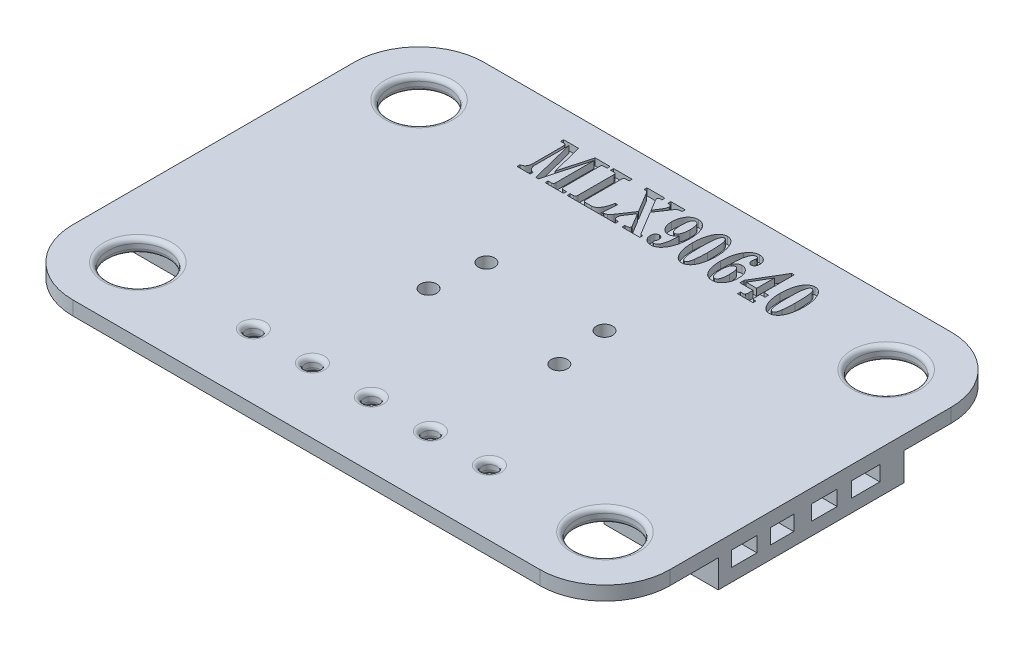
from build123d import *

# Parameters (mm, degrees)
SALIENTE_EXTRUIR1_DEPTH = 0.6
CROQUIS3_R              = 1.27
CROQUIS3_R_2            = 0.32
CROQUIS3_R_3            = 0.35
CORTAR_EXTRUIR1_DEPTH   = 16.614256306
REDONDEO1_R             = 0.2
REDONDEO2_R             = 0.2
CORTAR_EXTRUIR2_DEPTH   = 0.3
SALIENTE_EXTRUIR4_DEPTH = 1.2
REDONDEO3_R             = 0.01
CROQUIS7_W              = 0.961475499
CROQUIS7_H              = 0.984716881
CORTAR_EXTRUIR4_DEPTH   = 2.2
CROQUIS8_W              = 1.224767944
CROQUIS8_H              = 0.647945439
CROQUIS8_W_2            = 1.113290158
CROQUIS8_W_3            = 1.013233318
CROQUIS8_W_4            = 1.085589769
CORTAR_EXTRUIR5_DEPTH   = 2.2
CROQUIS9_W              = 1.132707072
CROQUIS9_H              = 1.963972998
CROQUIS9_H_2            = 0.661482274
CROQUIS9_H_3            = 0.757849479
CROQUIS9_W_2            = 0.741288448
CROQUIS9_H_4            = 1.36671407
CROQUIS9_W_3            = 2.633933759
CROQUIS9_H_5            = 1.322964549
CROQUIS9_W_4            = 1.348997922
CROQUIS9_H_6            = 0.958486138
CROQUIS9_W_5            = 0.714988108
CROQUIS9_H_7            = 0.958169502
CROQUIS9_W_6            = 0.459843401
CROQUIS9_H_8            = 0.258664748
SALIENTE_EXTRUIR5_DEPTH = 0.5
CROQUIS11_W             = 0.808334263
CROQUIS11_H             = 0.95
CORTAR_EXTRUIR7_DEPTH   = 17.744329696


with BuildPart() as part:
    # Croquis2 → Saliente-Extruir1 (new body)
    with BuildSketch(Plane(origin=(0, 0, 0), x_dir=(1, 0, 0), z_dir=(0, 1, 0))):
        with BuildLine():
            Line((-10.05, 8.85), (10.05, 8.85))
            ThreePointArc((10.05, 8.85), (12.029898987, 8.029898987), (12.85, 6.05))
            Line((12.85, 6.05), (12.85, -6.05))
            ThreePointArc((12.85, -6.05), (12.029898987, -8.029898987), (10.05, -8.85))
            Line((10.05, -8.85), (-10.05, -8.85))
            ThreePointArc((-10.05, -8.85), (-12.029898987, -8.029898987), (-12.85, -6.05))
            Line((-12.85, -6.05), (-12.85, 6.05))
            ThreePointArc((-12.85, 6.05), (-12.029898987, 8.029898987), (-10.05, 8.85))
        make_face()
    extrude(amount=SALIENTE_EXTRUIR1_DEPTH)

    # Croquis3 → Cortar-Extruir1 (cut, through all)
    with BuildSketch(Plane(origin=(0, 0.6, 0), x_dir=(1, 0, 0), z_dir=(0, 1, 0))):
        with Locations((-10.05, 6.05)):
            Circle(CROQUIS3_R)
        with Locations((10.05, 6.05)):
            Circle(CROQUIS3_R)
        with Locations((10.05, -6.05)):
            Circle(CROQUIS3_R)
        with Locations((-10.05, -6.05)):
            Circle(CROQUIS3_R)
        with Locations((-5.08, -6.05)):
            Circle(CROQUIS3_R_2)
        with Locations((-2.54, -6.05)):
            Circle(CROQUIS3_R_2)
        with Locations((0, -6.05)):
            Circle(CROQUIS3_R_2)
        with Locations((2.54, -6.05)):
            Circle(CROQUIS3_R_2)
        with Locations((5.08, -6.05)):
            Circle(CROQUIS3_R_2)
        with Locations((-2.54, 1.440416606)):
            Circle(CROQUIS3_R_3)
        with Locations((-2.814579574, -0.777522874)):
            Circle(CROQUIS3_R_3)
        with Locations((2.54, 1.440416606)):
            Circle(CROQUIS3_R_3)
        with Locations((2.814579574, -0.777522874)):
            Circle(CROQUIS3_R_3)
    extrude(amount=-CORTAR_EXTRUIR1_DEPTH, mode=Mode.SUBTRACT)

    # Redondeo1
    redondeo1_edges = [part.edges().sort_by_distance(p)[0] for p in [
        (-11.32, 0.6, 6.05),
        (-11.32, 0, 6.05),
        (8.78, 0.6, 6.05),
        (8.78, 0, 6.05),
        (8.78, 0.6, -6.05),
        (8.78, 0, -6.05),
        (-11.32, 0.6, -6.05),
        (-11.32, 0, -6.05),
    ]]
    fillet(redondeo1_edges, radius=REDONDEO1_R)

    # Redondeo2
    redondeo2_edges = [part.edges().sort_by_distance(p)[0] for p in [
        (4.76, 0.6, 6.05),
        (4.76, 0, 6.05),
        (2.22, 0.6, 6.05),
        (2.22, 0, 6.05),
        (-0.32, 0.6, 6.05),
        (-0.32, 0, 6.05),
        (-2.86, 0.6, 6.05),
        (-2.86, 0, 6.05),
        (-5.4, 0.6, 6.05),
        (-5.4, 0, 6.05),
    ]]
    fillet(redondeo2_edges, radius=REDONDEO2_R)

    # Croquis4 → Cortar-Extruir2 (cut)
    # profile 1 of 8: a face of its own
    with BuildSketch(Plane(origin=(0, 0.6, 0), x_dir=(1, 0, 0), z_dir=(0, 1, 0))):
        with BuildLine():
            Line((-5.460166621, 7.67960712), (-4.811929441, 7.67960712))
            Line((-4.811929441, 7.67960712), (-4.472987133, 6.324639172))
            Line((-4.472987133, 6.324639172), (-4.101993544, 7.67960712))
            Line((-4.101993544, 7.67960712), (-3.460166621, 7.67960712))
            Line((-3.460166621, 7.67960712), (-3.460166621, 7.551401992))
            Line((-3.460166621, 7.551401992), (-3.599990338, 7.551401992))
            add(Edge.make_bspline(
                [(-3.599990338, 7.551401992), (-3.607885575, 7.551089283), (-3.622616007, 7.550505849), (-3.642906166, 7.546470706), (-3.659367545, 7.538676571), (-3.672063713, 7.527480974), (-3.680751498, 7.512077414), (-3.686993972, 7.493208646), (-3.690382363, 7.469786931), (-3.690740654, 7.452854413), (-3.690935851, 7.443629556)],
                knots=[0, 0, 0, 0, 1.15018496, 2.145941985, 2.989722861, 3.774742299, 4.568626879, 5.534295969, 6.656681308, 8, 8, 8, 8], degree=3))
            Line((-3.690935851, 7.443629556), (-3.690935851, 5.919591095))
            add(Edge.make_bspline(
                [(-3.690935851, 5.919591095), (-3.690784739, 5.910753692), (-3.690505766, 5.89443877), (-3.686580928, 5.872144676), (-3.68017994, 5.85382314), (-3.673004478, 5.844537849), (-3.669701877, 5.840264172)],
                knots=[0, 0, 0, 0, 1.262263006, 2.330291258, 3.231494484, 4, 4, 4, 4], degree=3))
            add(Edge.make_bspline(
                [(-3.669701877, 5.840264172), (-3.664141557, 5.835340343), (-3.65292942, 5.825411662), (-3.632411992, 5.814899993), (-3.609016378, 5.808840483), (-3.592549479, 5.808164607), (-3.583964697, 5.807812248)],
                knots=[0, 0, 0, 0, 0.943981696, 1.903496961, 2.907018153, 4, 4, 4, 4], degree=3))
            Line((-3.583964697, 5.807812248), (-3.460166621, 5.807812248))
            Line((-3.460166621, 5.807812248), (-3.460166621, 5.67960712))
            Line((-3.460166621, 5.67960712), (-4.255038415, 5.67960712))
            Line((-4.255038415, 5.67960712), (-4.255038415, 5.807812248))
            Line((-4.255038415, 5.807812248), (-4.107602518, 5.807812248))
            add(Edge.make_bspline(
                [(-4.107602518, 5.807812248), (-4.101151241, 5.808193459), (-4.088781774, 5.808924381), (-4.071470928, 5.814576437), (-4.056908491, 5.82431521), (-4.044582186, 5.837325321), (-4.035627379, 5.854186937), (-4.028734864, 5.873598666), (-4.024782275, 5.895930352), (-4.024446077, 5.911696385), (-4.024269185, 5.919991736)],
                knots=[0, 0, 0, 0, 0.979439763, 1.877945847, 2.727924036, 3.618140293, 4.572229809, 5.605691173, 6.740226433, 8, 8, 8, 8], degree=3))
            Line((-4.024269185, 5.919991736), (-4.024269185, 7.553805838))
            Line((-4.024269185, 7.553805838), (-4.537490338, 5.67960712))
            Line((-4.537490338, 5.67960712), (-4.654076877, 5.67960712))
            Line((-4.654076877, 5.67960712), (-5.126833287, 7.57023212))
            Line((-5.126833287, 7.57023212), (-5.126833287, 6.110296223))
            add(Edge.make_bspline(
                [(-5.126833287, 6.110296223), (-5.126230354, 6.09033992), (-5.125066572, 6.05182026), (-5.113677099, 5.996930682), (-5.095177399, 5.947392448), (-5.069208549, 5.90385766), (-5.035841763, 5.866996145), (-4.99548519, 5.838115011), (-4.948200868, 5.81753002), (-4.913880253, 5.811133006), (-4.896064056, 5.807812248)],
                knots=[0, 0, 0, 0, 1.139508535, 2.199479606, 3.187665459, 4.149917366, 5.079361307, 6.009369364, 6.966642397, 8, 8, 8, 8], degree=3))
            Line((-4.896064056, 5.807812248), (-4.896064056, 5.67960712))
            Line((-4.896064056, 5.67960712), (-5.460166621, 5.67960712))
            Line((-5.460166621, 5.67960712), (-5.460166621, 5.807812248))
            add(Edge.make_bspline(
                [(-5.460166621, 5.807812248), (-5.442755413, 5.810707853), (-5.408951635, 5.816329655), (-5.361973004, 5.836545044), (-5.321433408, 5.86645213), (-5.288128542, 5.905680198), (-5.261639003, 5.95206144), (-5.243022371, 6.005012376), (-5.231028145, 6.063552997), (-5.229954242, 6.104624407), (-5.22939739, 6.125921223)],
                knots=[0, 0, 0, 0, 0.972888558, 1.888858541, 2.796851855, 3.733644671, 4.712424416, 5.732851946, 6.824412564, 8, 8, 8, 8], degree=3))
            Line((-5.22939739, 6.125921223), (-5.22939739, 7.415184043))
            add(Edge.make_bspline(
                [(-5.22939739, 7.415184043), (-5.229491139, 7.427757265), (-5.229662423, 7.450729097), (-5.2340664, 7.481640344), (-5.240329003, 7.50598982), (-5.250265791, 7.524549159), (-5.265223405, 7.537540657), (-5.284850223, 7.545581631), (-5.309113923, 7.550875101), (-5.326984444, 7.551215572), (-5.336769185, 7.551401992)],
                knots=[0, 0, 0, 0, 1.469642764, 2.685102424, 3.644577145, 4.400488364, 5.109044751, 5.913470196, 6.857551276, 8, 8, 8, 8], degree=3))
            Line((-5.336769185, 7.551401992), (-5.460166621, 7.551401992))
            Line((-5.460166621, 7.551401992), (-5.460166621, 7.67960712))
        make_face()
    # profile 2 of 8: a face of its own
    with BuildSketch(Plane(origin=(0, 0.6, 0), x_dir=(1, 0, 0), z_dir=(0, 1, 0))):
        with BuildLine():
            Line((-3.306320467, 7.551401992), (-3.306320467, 7.67960712))
            Line((-3.306320467, 7.67960712), (-2.511448672, 7.67960712))
            Line((-2.511448672, 7.67960712), (-2.511448672, 7.551401992))
            Line((-2.511448672, 7.551401992), (-2.641657005, 7.551401992))
            add(Edge.make_bspline(
                [(-2.641657005, 7.551401992), (-2.650248907, 7.551231279), (-2.666315315, 7.550912055), (-2.68830888, 7.545084722), (-2.706667242, 7.53652552), (-2.720772368, 7.523305159), (-2.730253285, 7.505930769), (-2.73771765, 7.485038184), (-2.741194013, 7.459494927), (-2.741859994, 7.441097026), (-2.742217903, 7.431209684)],
                knots=[0, 0, 0, 0, 1.130281163, 2.11356688, 2.980663753, 3.778726185, 4.616112224, 5.569397471, 6.693753316, 8, 8, 8, 8], degree=3))
            Line((-2.742217903, 7.431209684), (-2.742217903, 5.948036607))
            add(Edge.make_bspline(
                [(-2.742217903, 5.948036607), (-2.741874028, 5.934416891), (-2.741251872, 5.909775344), (-2.737889995, 5.876492389), (-2.7308767, 5.851377086), (-2.721268906, 5.831666313), (-2.703237192, 5.820080631), (-2.679542428, 5.813066519), (-2.648632257, 5.808470738), (-2.625515352, 5.80804579), (-2.612810851, 5.807812248)],
                knots=[0, 0, 0, 0, 1.414484932, 2.559164616, 3.453763437, 4.124068338, 4.770011535, 5.602576377, 6.682433025, 8, 8, 8, 8], degree=3))
            Line((-2.612810851, 5.807812248), (-2.382842903, 5.807812248))
            add(Edge.make_bspline(
                [(-2.382842903, 5.807812248), (-2.372253731, 5.808298899), (-2.35099472, 5.809275909), (-2.319498662, 5.816520261), (-2.288246051, 5.827528969), (-2.25828475, 5.844590426), (-2.228253465, 5.865041928), (-2.199131332, 5.890477437), (-2.170553552, 5.920457936), (-2.142500917, 5.954888316), (-2.115551452, 5.994536246), (-2.089832166, 6.039416431), (-2.06650552, 6.09031705), (-2.043975532, 6.14623051), (-2.023789204, 6.207756698), (-2.004883067, 6.274570359), (-1.987763953, 6.346912067), (-1.97801301, 6.397250958), (-1.972987133, 6.423196864)],
                knots=[0, 0, 0, 0, 0.639721852, 1.284317073, 1.945883481, 2.636051698, 3.361723358, 4.140315279, 4.968373853, 5.863732535, 6.822287117, 7.86386508, 8.987264374, 10.204773295, 11.506996104, 12.900050468, 14.402209527, 16, 16, 16, 16], degree=3))
            Line((-1.972987133, 6.423196864), (-1.870423031, 6.423196864))
            Line((-1.870423031, 6.423196864), (-1.921705082, 5.67960712))
            Line((-1.921705082, 5.67960712), (-3.306320467, 5.67960712))
            Line((-3.306320467, 5.67960712), (-3.306320467, 5.807812248))
            Line((-3.306320467, 5.807812248), (-3.168099313, 5.807812248))
            add(Edge.make_bspline(
                [(-3.168099313, 5.807812248), (-3.160838956, 5.808161074), (-3.147141289, 5.808819183), (-3.128022715, 5.814715198), (-3.111552928, 5.823847801), (-3.098400217, 5.837416592), (-3.087950348, 5.853890608), (-3.080811341, 5.873723942), (-3.076413697, 5.896427921), (-3.075849667, 5.912624153), (-3.075551236, 5.921193659)],
                knots=[0, 0, 0, 0, 1.046127115, 1.973663301, 2.863734559, 3.736709793, 4.673229106, 5.662122845, 6.763017659, 8, 8, 8, 8], degree=3))
            Line((-3.075551236, 5.921193659), (-3.075551236, 7.446033402))
            add(Edge.make_bspline(
                [(-3.075551236, 7.446033402), (-3.075863039, 7.454596373), (-3.076447573, 7.470649266), (-3.08056702, 7.492988263), (-3.088277581, 7.511548357), (-3.099001789, 7.526757007), (-3.113697823, 7.538609848), (-3.132881547, 7.54577941), (-3.155823442, 7.550767449), (-3.172604687, 7.551178622), (-3.181721108, 7.551401992)],
                knots=[0, 0, 0, 0, 1.18353027, 2.218749131, 3.120295434, 3.939903591, 4.767165038, 5.685742574, 6.742778477, 8, 8, 8, 8], degree=3))
            Line((-3.181721108, 7.551401992), (-3.306320467, 7.551401992))
        make_face()
    # profile 3 of 8: a face of its own
    with BuildSketch(Plane(origin=(0, 0.6, 0), x_dir=(1, 0, 0), z_dir=(0, 1, 0))):
        with BuildLine():
            Line((-1.870423031, 7.67960712), (-1.101192262, 7.67960712))
            Line((-1.101192262, 7.67960712), (-1.101192262, 7.551401992))
            Line((-1.101192262, 7.551401992), (-1.145663415, 7.551401992))
            add(Edge.make_bspline(
                [(-1.145663415, 7.551401992), (-1.155018602, 7.551163911), (-1.172323731, 7.55072351), (-1.196206915, 7.547800736), (-1.215699854, 7.542303228), (-1.231202899, 7.534796258), (-1.242325623, 7.52480023), (-1.250403942, 7.513497101), (-1.255362159, 7.500505338), (-1.255944669, 7.491214146), (-1.256240338, 7.486498146)],
                knots=[0, 0, 0, 0, 1.558103557, 2.882164341, 3.994074779, 4.919034571, 5.722385054, 6.456582808, 7.216596164, 8, 8, 8, 8], degree=3))
            add(Edge.make_bspline(
                [(-1.256240338, 7.486498146), (-1.255556289, 7.479765354), (-1.253972488, 7.464176726), (-1.244311063, 7.438896911), (-1.230994049, 7.40807035), (-1.218815831, 7.386494088), (-1.212169826, 7.3747193)],
                knots=[0, 0, 0, 0, 0.668297218, 1.547327892, 2.661506108, 4, 4, 4, 4], degree=3))
            Line((-1.212169826, 7.3747193), (-0.944942262, 6.930809043))
            Line((-0.944942262, 6.930809043), (-0.753836492, 7.237299428))
            add(Edge.make_bspline(
                [(-0.753836492, 7.237299428), (-0.743387085, 7.254158913), (-0.723411424, 7.286388428), (-0.701468197, 7.336547527), (-0.687746673, 7.38560987), (-0.685849124, 7.418175577), (-0.684926236, 7.434014172)],
                knots=[0, 0, 0, 0, 1.125444323, 2.151461086, 3.100948166, 4, 4, 4, 4], degree=3))
            add(Edge.make_bspline(
                [(-0.684926236, 7.434014172), (-0.685102517, 7.443005422), (-0.685435504, 7.459989449), (-0.691393821, 7.483623326), (-0.699984813, 7.50439631), (-0.713118267, 7.521267941), (-0.729179084, 7.535119301), (-0.748761037, 7.544662119), (-0.771549261, 7.550361097), (-0.787721067, 7.551041082), (-0.796304441, 7.551401992)],
                knots=[0, 0, 0, 0, 1.167507322, 2.205363595, 3.155556153, 4.07401267, 4.962666197, 5.896153595, 6.883359121, 8, 8, 8, 8], degree=3))
            Line((-0.796304441, 7.551401992), (-0.844782005, 7.551401992))
            Line((-0.844782005, 7.551401992), (-0.844782005, 7.67960712))
            Line((-0.844782005, 7.67960712), (-0.22939739, 7.67960712))
            Line((-0.22939739, 7.67960712), (-0.22939739, 7.551401992))
            Line((-0.22939739, 7.551401992), (-0.280679441, 7.551401992))
            add(Edge.make_bspline(
                [(-0.280679441, 7.551401992), (-0.291115822, 7.55098315), (-0.311608383, 7.550160724), (-0.341563229, 7.544689461), (-0.369373446, 7.534407799), (-0.396064078, 7.520328716), (-0.422425278, 7.500673496), (-0.449403785, 7.474512802), (-0.478968783, 7.442538799), (-0.497532506, 7.417651934), (-0.507442262, 7.404366736)],
                knots=[0, 0, 0, 0, 0.887635108, 1.742933233, 2.576389053, 3.399411665, 4.301173715, 5.361666336, 6.591594941, 8, 8, 8, 8], degree=3))
            Line((-0.507442262, 7.404366736), (-0.888451877, 6.836658402))
            Line((-0.888451877, 6.836658402), (-0.332762774, 5.913180838))
            add(Edge.make_bspline(
                [(-0.332762774, 5.913180838), (-0.327917649, 5.903514377), (-0.31891501, 5.885553304), (-0.305153766, 5.861560135), (-0.291996065, 5.842634046), (-0.275417673, 5.825148569), (-0.251590437, 5.810682899), (-0.230677243, 5.808771447), (-0.220182646, 5.807812248)],
                knots=[0, 0, 0, 0, 1.18868215, 2.208668397, 3.039972022, 3.714959018, 4.853327579, 6, 6, 6, 6], degree=3))
            Line((-0.220182646, 5.807812248), (-0.178115338, 5.807812248))
            Line((-0.178115338, 5.807812248), (-0.178115338, 5.67960712))
            Line((-0.178115338, 5.67960712), (-0.947346108, 5.67960712))
            Line((-0.947346108, 5.67960712), (-0.947346108, 5.807812248))
            Line((-0.947346108, 5.807812248), (-0.863211492, 5.807812248))
            add(Edge.make_bspline(
                [(-0.863211492, 5.807812248), (-0.853842432, 5.808099334), (-0.836453601, 5.808632159), (-0.812513766, 5.812934417), (-0.792577819, 5.819970137), (-0.776835475, 5.830519628), (-0.765700468, 5.843873318), (-0.756674839, 5.858061662), (-0.751960267, 5.874435442), (-0.751344865, 5.885779224), (-0.751032005, 5.891546223)],
                knots=[0, 0, 0, 0, 1.417441777, 2.630750014, 3.667113188, 4.597936438, 5.45754059, 6.282697974, 7.126950818, 8, 8, 8, 8], degree=3))
            add(Edge.make_bspline(
                [(-0.751032005, 5.891546223), (-0.75146862, 5.897067803), (-0.752430064, 5.909226544), (-0.759538828, 5.928114081), (-0.770567263, 5.949123888), (-0.780242883, 5.963228405), (-0.785487133, 5.970873146)],
                knots=[0, 0, 0, 0, 0.754806007, 1.662113079, 2.732849896, 4, 4, 4, 4], degree=3))
            Line((-0.785487133, 5.970873146), (-0.797506364, 5.990905197))
            Line((-0.797506364, 5.990905197), (-1.109205082, 6.508533402))
            Line((-1.109205082, 6.508533402), (-1.374429441, 6.113901992))
            add(Edge.make_bspline(
                [(-1.374429441, 6.113901992), (-1.382196682, 6.100888738), (-1.397453381, 6.07532763), (-1.412844915, 6.033818804), (-1.423126146, 5.991407712), (-1.424314444, 5.962519853), (-1.42491021, 5.948036607)],
                knots=[0, 0, 0, 0, 1.033185246, 2.029420192, 3.012028182, 4, 4, 4, 4], degree=3))
            add(Edge.make_bspline(
                [(-1.42491021, 5.948036607), (-1.424745228, 5.937707886), (-1.424433787, 5.918210092), (-1.418425511, 5.891388323), (-1.410665707, 5.867816105), (-1.401348611, 5.855436047), (-1.396865338, 5.849478915)],
                knots=[0, 0, 0, 0, 1.182439703, 2.232121997, 3.149318825, 4, 4, 4, 4], degree=3))
            add(Edge.make_bspline(
                [(-1.396865338, 5.849478915), (-1.390293929, 5.843169352), (-1.377275156, 5.830669329), (-1.353476393, 5.817193812), (-1.326818188, 5.809519344), (-1.308239649, 5.808391082), (-1.298708287, 5.807812248)],
                knots=[0, 0, 0, 0, 0.993605278, 1.96845444, 2.957754649, 4, 4, 4, 4], degree=3))
            Line((-1.298708287, 5.807812248), (-1.22939739, 5.807812248))
            Line((-1.22939739, 5.807812248), (-1.22939739, 5.67960712))
            Line((-1.22939739, 5.67960712), (-1.870423031, 5.67960712))
            Line((-1.870423031, 5.67960712), (-1.870423031, 5.807812248))
            Line((-1.870423031, 5.807812248), (-1.830358928, 5.807812248))
            add(Edge.make_bspline(
                [(-1.830358928, 5.807812248), (-1.822152184, 5.808268074), (-1.805135067, 5.809213253), (-1.779866143, 5.817618174), (-1.753652449, 5.829598375), (-1.737244261, 5.841043018), (-1.728596108, 5.847075069)],
                knots=[0, 0, 0, 0, 0.886553312, 1.838314975, 2.860655259, 4, 4, 4, 4], degree=3))
            add(Edge.make_bspline(
                [(-1.728596108, 5.847075069), (-1.714487215, 5.858173992), (-1.687081077, 5.879733345), (-1.650729171, 5.915359547), (-1.618448584, 5.951287844), (-1.600671434, 5.97708646), (-1.591977518, 5.989703274)],
                knots=[0, 0, 0, 0, 1.084770849, 2.107137611, 3.074295593, 4, 4, 4, 4], degree=3))
            Line((-1.591977518, 5.989703274), (-1.172506364, 6.613501351))
            Line((-1.172506364, 6.613501351), (-1.674108928, 7.447635966))
            add(Edge.make_bspline(
                [(-1.674108928, 7.447635966), (-1.680237807, 7.457617675), (-1.691470827, 7.47591217), (-1.708969081, 7.499698131), (-1.724155652, 7.518511102), (-1.739284188, 7.531961344), (-1.755078876, 7.540558327), (-1.771887354, 7.547426387), (-1.791105736, 7.550698222), (-1.804576513, 7.551162419), (-1.8115288, 7.551401992)],
                knots=[0, 0, 0, 0, 1.538085936, 2.819006711, 3.877115485, 4.710651645, 5.457096884, 6.229285643, 7.086131807, 8, 8, 8, 8], degree=3))
            Line((-1.8115288, 7.551401992), (-1.870423031, 7.551401992))
            Line((-1.870423031, 7.551401992), (-1.870423031, 7.67960712))
        make_face()
    # profile 4 of 8: a face of its own
    with BuildSketch(Plane(origin=(0, 0.6, 0), x_dir=(1, 0, 0), z_dir=(0, 1, 0))):
        with BuildLine():
            Line((0.616756456, 6.57023212), (0.599929533, 6.552603915))
            add(Edge.make_bspline(
                [(0.599929533, 6.552603915), (0.58868451, 6.540208369), (0.566878401, 6.516171191), (0.531197785, 6.485170652), (0.496235165, 6.457945547), (0.460427007, 6.436085811), (0.424475593, 6.418536246), (0.387770148, 6.40661731), (0.350917545, 6.398933185), (0.326195115, 6.398014014), (0.313871841, 6.397555838)],
                knots=[0, 0, 0, 0, 1.196484651, 2.320197477, 3.377117536, 4.363747395, 5.316906428, 6.232537762, 7.118981323, 8, 8, 8, 8], degree=3))
            add(Edge.make_bspline(
                [(0.313871841, 6.397555838), (0.30237187, 6.398010664), (0.279524809, 6.398914269), (0.245573427, 6.404043098), (0.212798629, 6.413516452), (0.180752706, 6.425771932), (0.150175775, 6.442568843), (0.120615393, 6.462638524), (0.091694957, 6.486018576), (0.074109077, 6.50406775), (0.065073764, 6.513341095)],
                knots=[0, 0, 0, 0, 0.976991601, 1.940994943, 2.906864445, 3.869332165, 4.84869064, 5.861557092, 6.901306, 8, 8, 8, 8], degree=3))
            add(Edge.make_bspline(
                [(0.065073764, 6.513341095), (0.0538217, 6.526191282), (0.031139802, 6.552094675), (0.002425669, 6.595592636), (-0.021820702, 6.642915291), (-0.041288723, 6.694187427), (-0.057108258, 6.749073851), (-0.0675021, 6.808038893), (-0.074728618, 6.87066656), (-0.075271899, 6.913826148), (-0.075551236, 6.936017377)],
                knots=[0, 0, 0, 0, 0.897409125, 1.808996208, 2.732436718, 3.68844509, 4.688825109, 5.73157232, 6.833649742, 8, 8, 8, 8], degree=3))
            add(Edge.make_bspline(
                [(-0.075551236, 6.936017377), (-0.07483372, 6.968243585), (-0.07343508, 7.031061548), (-0.061085198, 7.122260258), (-0.04172669, 7.207866826), (-0.01417383, 7.28716204), (0.020359439, 7.359197186), (0.061429047, 7.422988794), (0.108970962, 7.47779474), (0.16301923, 7.522988225), (0.222547563, 7.5585877), (0.286750438, 7.58465819), (0.355925574, 7.599621099), (0.403411075, 7.601648826), (0.427653892, 7.602684043)],
                knots=[0, 0, 0, 0, 1.238702551, 2.414580451, 3.53199289, 4.608780327, 5.635467374, 6.596944679, 7.517733791, 8.414597314, 9.29443526, 10.174632825, 11.068093574, 12, 12, 12, 12], degree=3))
            add(Edge.make_bspline(
                [(0.427653892, 7.602684043), (0.446535638, 7.602146378), (0.483510638, 7.6010935), (0.537157105, 7.590538207), (0.587930646, 7.574634874), (0.635568785, 7.551736572), (0.679447801, 7.521429887), (0.720766024, 7.485580341), (0.758646563, 7.442799112), (0.780317719, 7.410513804), (0.791435944, 7.393950069)],
                knots=[0, 0, 0, 0, 1.030004428, 2.016996528, 2.974194318, 3.929946188, 4.890804615, 5.878093081, 6.911371588, 8, 8, 8, 8], degree=3))
            add(Edge.make_bspline(
                [(0.791435944, 7.393950069), (0.804304306, 7.372284773), (0.830492702, 7.328193745), (0.862002359, 7.256314921), (0.889395086, 7.179490252), (0.911813216, 7.097130791), (0.928790696, 7.009243163), (0.941054207, 6.916128892), (0.948917248, 6.817696388), (0.94969212, 6.75026901), (0.95008979, 6.715664813)],
                knots=[0, 0, 0, 0, 0.856490841, 1.743043919, 2.664088793, 3.629506453, 4.643398542, 5.706719311, 6.823072443, 8, 8, 8, 8], degree=3))
            add(Edge.make_bspline(
                [(0.95008979, 6.715664813), (0.949662613, 6.674777855), (0.94882804, 6.594897144), (0.939073792, 6.478047892), (0.924903469, 6.367008377), (0.903330833, 6.262192827), (0.876972896, 6.163136481), (0.843210588, 6.07045362), (0.805190729, 5.98285168), (0.773424273, 5.928920081), (0.757782097, 5.902363531)],
                knots=[0, 0, 0, 0, 1.159134297, 2.264596781, 3.322920871, 4.331508659, 5.297052742, 6.226612366, 7.126763147, 8, 8, 8, 8], degree=3))
            add(Edge.make_bspline(
                [(0.757782097, 5.902363531), (0.743476926, 5.880719753), (0.71588034, 5.838966017), (0.669532767, 5.782774276), (0.620683997, 5.735047441), (0.569007873, 5.696313325), (0.51525796, 5.665447399), (0.458649089, 5.644349753), (0.399709164, 5.630816559), (0.359485371, 5.629162727), (0.339112226, 5.628325069)],
                knots=[0, 0, 0, 0, 1.187942102, 2.291698946, 3.330138337, 4.309052433, 5.24323766, 6.159111887, 7.067599579, 8, 8, 8, 8], degree=3))
            add(Edge.make_bspline(
                [(0.339112226, 5.628325069), (0.326279705, 5.628636433), (0.301055932, 5.629248453), (0.264084201, 5.633957149), (0.229058435, 5.642652161), (0.195364524, 5.653750515), (0.16342898, 5.668616245), (0.133163605, 5.686684475), (0.104936129, 5.708320372), (0.078409001, 5.732335572), (0.054579296, 5.75865324), (0.033682951, 5.786081383), (0.015410276, 5.813981361), (0.000964643, 5.843093995), (-0.010289394, 5.87276337), (-0.018433152, 5.903213736), (-0.023335065, 5.934388009), (-0.023957571, 5.955498133), (-0.024269185, 5.966065454)],
                knots=[0, 0, 0, 0, 1.119486502, 2.200477538, 3.2432444, 4.263839697, 5.290799687, 6.309864206, 7.332850904, 8.388555815, 9.427801789, 10.425188767, 11.394762525, 12.332666694, 13.254512173, 14.158889132, 15.078375437, 16, 16, 16, 16], degree=3))
            add(Edge.make_bspline(
                [(-0.024269185, 5.966065454), (-0.023720775, 5.981883413), (-0.02266389, 6.01236749), (-0.012699224, 6.055747082), (0.002744031, 6.095139852), (0.025378219, 6.128980673), (0.052082386, 6.157229404), (0.083026392, 6.177367407), (0.116714246, 6.190267004), (0.140413508, 6.191701356), (0.152413508, 6.192427633)],
                knots=[0, 0, 0, 0, 1.186576379, 2.286747979, 3.326331444, 4.347550062, 5.326651257, 6.225460365, 7.101470903, 8, 8, 8, 8], degree=3))
            add(Edge.make_bspline(
                [(0.152413508, 6.192427633), (0.163202743, 6.191929473), (0.184391095, 6.190951166), (0.214359611, 6.179581321), (0.241992458, 6.162687502), (0.265136733, 6.138163725), (0.284839918, 6.109633054), (0.298942064, 6.076969134), (0.307632551, 6.041035195), (0.308575594, 6.015930311), (0.309064149, 6.002924428)],
                knots=[0, 0, 0, 0, 0.941368798, 1.848699551, 2.774576644, 3.759849283, 4.779583325, 5.802002649, 6.861301417, 8, 8, 8, 8], degree=3))
            add(Edge.make_bspline(
                [(0.309064149, 6.002924428), (0.308602977, 5.995152341), (0.307597903, 5.9782139), (0.301208468, 5.951411754), (0.290454836, 5.921722586), (0.28141913, 5.90124054), (0.276612226, 5.8903443)],
                knots=[0, 0, 0, 0, 0.790790221, 1.723443658, 2.788895119, 4, 4, 4, 4], degree=3))
            add(Edge.make_bspline(
                [(0.276612226, 5.8903443), (0.273653384, 5.884127923), (0.268149899, 5.872565382), (0.262657265, 5.855405522), (0.258665519, 5.840443731), (0.258056877, 5.830935146), (0.257782097, 5.826642377)],
                knots=[0, 0, 0, 0, 1.233440906, 2.294216321, 3.229902753, 4, 4, 4, 4], degree=3))
            add(Edge.make_bspline(
                [(0.257782097, 5.826642377), (0.258506989, 5.817601184), (0.259894989, 5.800289378), (0.270936545, 5.786944227), (0.276211585, 5.780568659)],
                knots=[0, 0, 0, 0, 1.044511692, 2, 2, 2, 2], degree=3))
            add(Edge.make_bspline(
                [(0.276211585, 5.780568659), (0.28076185, 5.776913007), (0.289839584, 5.769620018), (0.305900965, 5.761856455), (0.323921001, 5.757457464), (0.336549787, 5.75684748), (0.343118636, 5.756530197)],
                knots=[0, 0, 0, 0, 0.960893565, 1.91697313, 2.916515877, 4, 4, 4, 4], degree=3))
            add(Edge.make_bspline(
                [(0.343118636, 5.756530197), (0.354343621, 5.757527941), (0.377502212, 5.759586415), (0.41116659, 5.775000422), (0.443863133, 5.798949285), (0.46998024, 5.825544152), (0.490140261, 5.851821174), (0.504778646, 5.875557395), (0.518999383, 5.902247882), (0.532029342, 5.932327373), (0.544437888, 5.965633853), (0.555916963, 6.002042161), (0.566845016, 6.041575166), (0.576716674, 6.08450451), (0.586189252, 6.131051703), (0.593455579, 6.181798151), (0.600345302, 6.236406343), (0.605941394, 6.295194737), (0.610135562, 6.358130562), (0.613981172, 6.425160503), (0.615703883, 6.496373498), (0.616398651, 6.545125042), (0.616756456, 6.57023212)],
                knots=[0, 0, 0, 0, 0.731231462, 1.50862479, 2.377284779, 3.369952308, 3.929759604, 4.536992694, 5.188381921, 5.902837495, 6.675374673, 7.508153346, 8.394488093, 9.352586562, 10.383722197, 11.494782052, 12.698495803, 13.977361549, 15.34965681, 16.816609609, 18.360551808, 20, 20, 20, 20], degree=3))
        make_face()
        with BuildLine():
            add(Edge.make_bspline(
                [(0.436868636, 7.474478915), (0.43028697, 7.474209933), (0.417176955, 7.473674147), (0.39821501, 7.468143254), (0.380288299, 7.459695594), (0.363665985, 7.447567177), (0.347454598, 7.432800373), (0.332761256, 7.4141088), (0.319088553, 7.392145851), (0.306210537, 7.366736424), (0.294488615, 7.337165203), (0.284665309, 7.30292769), (0.276271469, 7.26383913), (0.26979002, 7.219779651), (0.263938937, 7.170912023), (0.260775575, 7.117137118), (0.258140525, 7.058505952), (0.257904891, 7.017751933), (0.257782097, 6.996514172)],
                knots=[0, 0, 0, 0, 0.568014167, 1.131427042, 1.694721442, 2.274942362, 2.904486147, 3.586545602, 4.323812486, 5.14020991, 6.047744996, 7.071404849, 8.218076188, 9.504070267, 10.922871356, 12.474554331, 14.162817409, 16, 16, 16, 16], degree=3))
            add(Edge.make_bspline(
                [(0.257782097, 6.996514172), (0.25796576, 6.978083539), (0.258318558, 6.942680023), (0.260155062, 6.891757414), (0.26385502, 6.845001425), (0.268546496, 6.802359492), (0.27435862, 6.763790275), (0.281899399, 6.729489967), (0.291097924, 6.699376763), (0.301445121, 6.673047908), (0.313169348, 6.650466139), (0.325630478, 6.63090376), (0.339130557, 6.614358392), (0.353920061, 6.601069972), (0.368963633, 6.589718209), (0.385814471, 6.58269435), (0.40335697, 6.577971829), (0.415468755, 6.577356672), (0.421644277, 6.577043018)],
                knots=[0, 0, 0, 0, 1.801015352, 3.45958137, 4.977868596, 6.382914916, 7.650863732, 8.787441464, 9.811138556, 10.724694347, 11.547638794, 12.293287582, 12.988347735, 13.625637459, 14.233944141, 14.818263011, 15.397459388, 16, 16, 16, 16], degree=3))
            add(Edge.make_bspline(
                [(0.421644277, 6.577043018), (0.428348739, 6.577494169), (0.441688269, 6.578391803), (0.46140211, 6.583646493), (0.479846651, 6.593254217), (0.497889359, 6.60578921), (0.514654381, 6.622526527), (0.530503456, 6.642810785), (0.546450227, 6.666077275), (0.560598802, 6.693498689), (0.573882453, 6.724370381), (0.585435652, 6.759095904), (0.59540343, 6.797493312), (0.60333275, 6.839664131), (0.609204011, 6.885564135), (0.613501067, 6.935152043), (0.616447794, 6.988466079), (0.616651392, 7.02522254), (0.616756456, 7.044190454)],
                knots=[0, 0, 0, 0, 0.586819603, 1.167565273, 1.768167253, 2.396729322, 3.082167887, 3.829934121, 4.646152192, 5.54468673, 6.523005991, 7.582890281, 8.741383612, 9.98963491, 11.332418653, 12.786195468, 14.341538713, 16, 16, 16, 16], degree=3))
            add(Edge.make_bspline(
                [(0.616756456, 7.044190454), (0.616704343, 7.063428887), (0.616604015, 7.10046655), (0.612994139, 7.15402292), (0.608751145, 7.203585617), (0.601129871, 7.249082087), (0.592936967, 7.290787276), (0.581238398, 7.328191203), (0.569156617, 7.362173391), (0.557990724, 7.382318393), (0.552653892, 7.391946864)],
                knots=[0, 0, 0, 0, 1.291792121, 2.486946844, 3.604412318, 4.630791511, 5.584306396, 6.45549698, 7.261791922, 8, 8, 8, 8], degree=3))
            add(Edge.make_bspline(
                [(0.552653892, 7.391946864), (0.544721975, 7.404333518), (0.529945809, 7.427408298), (0.501939895, 7.454650148), (0.47023127, 7.471272595), (0.447858498, 7.473422733), (0.436868636, 7.474478915)],
                knots=[0, 0, 0, 0, 1.182358079, 2.202584547, 3.117080901, 4, 4, 4, 4], degree=3))
        make_face(mode=Mode.SUBTRACT)
    # profile 5 of 8: a face of its own
    with BuildSketch(Plane(origin=(0, 0.6, 0), x_dir=(1, 0, 0), z_dir=(0, 1, 0))):
        with BuildLine():
            add(Edge.make_bspline(
                [(1.674448764, 7.602684043), (1.685685308, 7.602384555), (1.707995145, 7.60178993), (1.740994793, 7.596755182), (1.773315567, 7.588907426), (1.804511141, 7.576942016), (1.835335298, 7.562681528), (1.864802825, 7.544327018), (1.894011337, 7.523517658), (1.922015013, 7.498811026), (1.949471683, 7.47087601), (1.975032747, 7.438343448), (1.999983078, 7.402120075), (2.02396197, 7.361777001), (2.0463033, 7.317080037), (2.067413237, 7.268430442), (2.087993807, 7.215863597), (2.106923171, 7.159260817), (2.124674168, 7.099648996), (2.139338585, 7.037104753), (2.152081789, 6.972281518), (2.163097301, 6.904988648), (2.1709181, 6.835308039), (2.176412935, 6.763274796), (2.180219595, 6.688862326), (2.180643709, 6.638345955), (2.180859021, 6.612700069)],
                knots=[0, 0, 0, 0, 0.663339482, 1.317041558, 1.967499435, 2.62390856, 3.287248042, 3.970410989, 4.670975563, 5.403367482, 6.173161291, 6.981282737, 7.843346953, 8.770006062, 9.750686076, 10.792673402, 11.901542214, 13.08389459, 14.316942011, 15.573927542, 16.876468426, 18.218650723, 19.600192701, 21.016449575, 22.485326743, 24, 24, 24, 24], degree=3))
            add(Edge.make_bspline(
                [(2.180859021, 6.612700069), (2.180587556, 6.586923453), (2.180054263, 6.536285161), (2.177058958, 6.461561009), (2.170848357, 6.389433398), (2.162872564, 6.319823968), (2.153185795, 6.25275868), (2.140029841, 6.188579157), (2.125526638, 6.126843016), (2.108123195, 6.06814396), (2.089575118, 6.012564785), (2.069083674, 5.960879566), (2.047513508, 5.913099794), (2.02466531, 5.869127965), (2.000304258, 5.829100564), (1.974652179, 5.79291029), (1.947831206, 5.760509739), (1.919229918, 5.732520069), (1.889838176, 5.707945637), (1.85991647, 5.686600902), (1.829057405, 5.66894227), (1.797912805, 5.65378184), (1.765517046, 5.642781298), (1.732657619, 5.634076577), (1.698896018, 5.629285297), (1.676198333, 5.628645448), (1.664833379, 5.628325069)],
                knots=[0, 0, 0, 0, 1.518990342, 2.984064212, 4.405477933, 5.783780636, 7.112625604, 8.396675487, 9.643060723, 10.84834845, 12.003043378, 13.094660524, 14.123034393, 15.091010656, 16.012813673, 16.881882058, 17.703063719, 18.487685356, 19.236319332, 19.959025967, 20.65010665, 21.329483593, 21.996487542, 22.662608873, 23.330355175, 24, 24, 24, 24], degree=3))
            add(Edge.make_bspline(
                [(1.664833379, 5.628325069), (1.647806632, 5.628973511), (1.614330666, 5.630248402), (1.565365824, 5.641765695), (1.518497688, 5.65952836), (1.474584688, 5.68603376), (1.432328723, 5.718452658), (1.393782934, 5.759501316), (1.355846347, 5.8062165), (1.334535681, 5.841831648), (1.323487226, 5.860296223)],
                knots=[0, 0, 0, 0, 0.940793043, 1.849675459, 2.76907037, 3.703077534, 4.677147136, 5.706594557, 6.810990323, 8, 8, 8, 8], degree=3))
            add(Edge.make_bspline(
                [(1.323487226, 5.860296223), (1.3100035, 5.88493732), (1.282615964, 5.934987208), (1.248342119, 6.01502628), (1.21949726, 6.100403), (1.195985204, 6.191078243), (1.177663893, 6.287042645), (1.164449378, 6.388165705), (1.156954155, 6.494664111), (1.155806133, 6.567416026), (1.155217995, 6.604687248)],
                knots=[0, 0, 0, 0, 0.872900335, 1.772995842, 2.702590703, 3.67238308, 4.68291504, 5.738142911, 6.841237646, 8, 8, 8, 8], degree=3))
            add(Edge.make_bspline(
                [(1.155217995, 6.604687248), (1.155488168, 6.631131544), (1.156017799, 6.682971248), (1.159018744, 6.759430326), (1.165222672, 6.83302588), (1.173136244, 6.903849603), (1.183036762, 6.971782567), (1.19552287, 7.036867664), (1.210135576, 7.099225682), (1.22751397, 7.158470039), (1.246222006, 7.214336264), (1.266104291, 7.266603481), (1.287761867, 7.314705625), (1.310683885, 7.358943706), (1.33442402, 7.39944713), (1.359954206, 7.435711924), (1.386231452, 7.468461828), (1.414459561, 7.496988409), (1.443843459, 7.521835595), (1.473830199, 7.543664366), (1.504994782, 7.561855073), (1.537080133, 7.576689018), (1.570076756, 7.58835284), (1.603968434, 7.596944191), (1.638919264, 7.601744947), (1.662549225, 7.602369521), (1.674448764, 7.602684043)],
                knots=[0, 0, 0, 0, 1.537483313, 3.01398384, 4.447331496, 5.830335917, 7.156760814, 8.437379225, 9.682192412, 10.878807874, 12.025411346, 13.106835937, 14.128525988, 15.090438158, 16.002555376, 16.85552, 17.666755657, 18.440879445, 19.184499463, 19.902045446, 20.594495047, 21.278844519, 21.954149328, 22.626412207, 23.308290777, 24, 24, 24, 24], degree=3))
        make_face()
        with BuildLine():
            add(Edge.make_bspline(
                [(1.847525687, 6.559414813), (1.847374215, 6.583586634), (1.847077128, 6.630995483), (1.846944967, 6.700445893), (1.845606361, 6.76668527), (1.843984108, 6.829718692), (1.842219116, 6.889567204), (1.839073571, 6.946298525), (1.836605087, 6.9998866), (1.832920803, 7.050228853), (1.828752977, 7.097347253), (1.824997624, 7.141335595), (1.820324672, 7.182109263), (1.814356709, 7.219548325), (1.80920067, 7.254008362), (1.802447435, 7.285148249), (1.796473251, 7.313387048), (1.791151131, 7.330812459), (1.788631456, 7.339062248)],
                knots=[0, 0, 0, 0, 1.480142987, 2.903044657, 4.252548685, 5.536826642, 6.764127021, 7.91856902, 9.015842876, 10.048828057, 11.009079247, 11.91230931, 12.752162796, 13.521235482, 14.233754677, 14.884877768, 15.472062728, 16, 16, 16, 16], degree=3))
            add(Edge.make_bspline(
                [(1.788631456, 7.339062248), (1.785013059, 7.349650687), (1.778146485, 7.369744197), (1.76651893, 7.397743507), (1.752522509, 7.42080539), (1.739018184, 7.440806281), (1.722795784, 7.455257126), (1.706374056, 7.466608506), (1.688172486, 7.473436153), (1.675571046, 7.47413023), (1.669240431, 7.474478915)],
                knots=[0, 0, 0, 0, 1.391291126, 2.640230703, 3.756230379, 4.742329745, 5.623354831, 6.438253056, 7.215421442, 8, 8, 8, 8], degree=3))
            add(Edge.make_bspline(
                [(1.669240431, 7.474478915), (1.661679544, 7.473807659), (1.646571961, 7.472466406), (1.624800473, 7.463065931), (1.605391791, 7.447002678), (1.587223102, 7.425504216), (1.571457201, 7.39756118), (1.556664389, 7.363997823), (1.543191342, 7.32447552), (1.531561971, 7.277953397), (1.521004901, 7.223021083), (1.512631163, 7.157434726), (1.504991167, 7.080757925), (1.499431353, 6.992676473), (1.493868101, 6.893605501), (1.491129921, 6.783117678), (1.489022532, 6.661453158), (1.488712933, 6.576510091), (1.488551328, 6.532171223)],
                knots=[0, 0, 0, 0, 0.360769338, 0.720861598, 1.111301704, 1.554714226, 2.057854895, 2.637406442, 3.304982053, 4.049000482, 4.925793376, 5.974761635, 7.205234338, 8.605192538, 10.188999209, 11.943570481, 13.882611284, 16, 16, 16, 16], degree=3))
            add(Edge.make_bspline(
                [(1.488551328, 6.532171223), (1.488611419, 6.494908224), (1.488727103, 6.423171293), (1.492207834, 6.319928663), (1.496729914, 6.225197766), (1.503502838, 6.138883452), (1.51208162, 6.060939195), (1.522804765, 5.991548077), (1.535202926, 5.930550746), (1.546267059, 5.893352967), (1.551451969, 5.875921223)],
                knots=[0, 0, 0, 0, 1.352010722, 2.602825958, 3.747910308, 4.793007349, 5.743931538, 6.592401915, 7.340366834, 8, 8, 8, 8], degree=3))
            add(Edge.make_bspline(
                [(1.551451969, 5.875921223), (1.554715647, 5.866484674), (1.560891961, 5.848626573), (1.572914715, 5.824472462), (1.58474276, 5.803373996), (1.598875271, 5.786787857), (1.61310797, 5.773041156), (1.62920402, 5.763671634), (1.646267355, 5.757760216), (1.658110013, 5.756940238), (1.664032097, 5.756530197)],
                knots=[0, 0, 0, 0, 1.364554383, 2.58233723, 3.688620783, 4.661948597, 5.554377562, 6.381760188, 7.190776916, 8, 8, 8, 8], degree=3))
            add(Edge.make_bspline(
                [(1.664032097, 5.756530197), (1.671893474, 5.757113071), (1.688044853, 5.758310598), (1.710892945, 5.769737908), (1.732111271, 5.787352674), (1.748673385, 5.806814847), (1.760951901, 5.826952551), (1.770255323, 5.846349649), (1.778232183, 5.869774431), (1.786963119, 5.896605919), (1.794187799, 5.927498917), (1.801621226, 5.962034383), (1.807685619, 6.000488079), (1.811750598, 6.027362166), (1.813871841, 6.041385966)],
                knots=[0, 0, 0, 0, 0.811212996, 1.666655725, 2.592783854, 3.664306599, 4.298780422, 5.036239252, 5.890896193, 6.863728428, 7.962581978, 9.179953515, 10.528405037, 12, 12, 12, 12], degree=3))
            add(Edge.make_bspline(
                [(1.813871841, 6.041385966), (1.819163114, 6.081946851), (1.829949903, 6.164634284), (1.839761246, 6.291660559), (1.846575413, 6.423789131), (1.847204672, 6.513598658), (1.847525687, 6.559414813)],
                knots=[0, 0, 0, 0, 0.944661221, 1.925786666, 2.941844108, 4, 4, 4, 4], degree=3))
        make_face(mode=Mode.SUBTRACT)
    # profile 6 of 8: a face of its own
    with BuildSketch(Plane(origin=(0, 0.6, 0), x_dir=(1, 0, 0), z_dir=(0, 1, 0))):
        with BuildLine():
            add(Edge.make_bspline(
                [(2.77060261, 6.647155197), (2.781935006, 6.662086322), (2.80372733, 6.690799044), (2.839842316, 6.728465039), (2.875763672, 6.761027116), (2.912949684, 6.787262172), (2.950627312, 6.808025127), (2.989214138, 6.822547605), (3.028430341, 6.831949418), (3.055005689, 6.832952353), (3.068278892, 6.833453274)],
                knots=[0, 0, 0, 0, 1.23292911, 2.370936551, 3.429534303, 4.419820362, 5.359983084, 6.253099055, 7.127500711, 8, 8, 8, 8], degree=3))
            add(Edge.make_bspline(
                [(3.068278892, 6.833453274), (3.080859818, 6.833106062), (3.105789519, 6.832418045), (3.142663869, 6.825728773), (3.178461326, 6.814752451), (3.213518136, 6.799967824), (3.247368467, 6.78054284), (3.279865945, 6.75658185), (3.311668079, 6.728754004), (3.342508818, 6.696927418), (3.370913092, 6.660536152), (3.39596755, 6.619782666), (3.41680118, 6.574563501), (3.433501461, 6.524940047), (3.446582899, 6.471169782), (3.456227861, 6.413204115), (3.46173532, 6.350921261), (3.462510256, 6.307956702), (3.462910303, 6.285776992)],
                knots=[0, 0, 0, 0, 0.801112574, 1.58744253, 2.378959507, 3.183545291, 4.006905936, 4.859735582, 5.75239954, 6.697365374, 7.679648978, 8.688235248, 9.739128545, 10.845257017, 12.01972902, 13.262137148, 14.586625719, 16, 16, 16, 16], degree=3))
            add(Edge.make_bspline(
                [(3.462910303, 6.285776992), (3.46256874, 6.261724064), (3.461899512, 6.214596899), (3.455413705, 6.145776114), (3.444662883, 6.080413116), (3.429472014, 6.018807867), (3.41031421, 5.960680778), (3.386518276, 5.906253568), (3.358539423, 5.855397891), (3.326633841, 5.808423965), (3.290903356, 5.766540675), (3.252975592, 5.729218619), (3.211696897, 5.698082415), (3.16769884, 5.672851558), (3.121380957, 5.652350822), (3.072120501, 5.638583371), (3.020381859, 5.62982591), (2.984982101, 5.62883219), (2.966916713, 5.628325069)],
                knots=[0, 0, 0, 0, 1.251386465, 2.451855246, 3.593198004, 4.6955157, 5.750370536, 6.774232385, 7.782000866, 8.766988142, 9.723543762, 10.64258278, 11.53072894, 12.405644407, 13.277103063, 14.159137927, 15.06056168, 16, 16, 16, 16], degree=3))
            add(Edge.make_bspline(
                [(2.966916713, 5.628325069), (2.947898133, 5.628841096), (2.910495384, 5.629855936), (2.856147126, 5.640830006), (2.804661208, 5.657458953), (2.7566066, 5.681608472), (2.711109355, 5.71185128), (2.66918667, 5.749527313), (2.629766844, 5.793413687), (2.607411695, 5.826742087), (2.595923123, 5.843869941)],
                knots=[0, 0, 0, 0, 1.014513493, 1.995185427, 2.949349228, 3.896796968, 4.858291608, 5.858816018, 6.899620577, 8, 8, 8, 8], degree=3))
            add(Edge.make_bspline(
                [(2.595923123, 5.843869941), (2.583059511, 5.865537038), (2.556880783, 5.909631732), (2.525194148, 5.981712935), (2.497921305, 6.059265899), (2.475559521, 6.142704939), (2.45849814, 6.232045048), (2.44627292, 6.32717095), (2.438449463, 6.42814054), (2.437669365, 6.497434026), (2.437269277, 6.532972505)],
                knots=[0, 0, 0, 0, 0.843717674, 1.717049257, 2.632795037, 3.596772494, 4.608721258, 5.678367082, 6.809306511, 8, 8, 8, 8], degree=3))
            add(Edge.make_bspline(
                [(2.437269277, 6.532972505), (2.43793557, 6.573317579), (2.439236697, 6.65210283), (2.447884821, 6.767332724), (2.463253538, 6.876450314), (2.48370763, 6.979783028), (2.510965065, 7.077023336), (2.544401858, 7.168115039), (2.582694997, 7.253886311), (2.614354992, 7.306627073), (2.62997761, 7.332651992)],
                knots=[0, 0, 0, 0, 1.161882794, 2.268907142, 3.325163533, 4.333600785, 5.300364536, 6.229922328, 7.126555524, 8, 8, 8, 8], degree=3))
            add(Edge.make_bspline(
                [(2.62997761, 7.332651992), (2.644224785, 7.354081081), (2.671804517, 7.39556359), (2.719072146, 7.450420468), (2.768065637, 7.497829334), (2.820276053, 7.536043106), (2.8751576, 7.565786147), (2.932367177, 7.587313526), (2.992405418, 7.600007359), (3.033230719, 7.601785646), (3.053855815, 7.602684043)],
                knots=[0, 0, 0, 0, 1.173291365, 2.271261706, 3.297219876, 4.278491213, 5.213815187, 6.137531445, 7.05907387, 8, 8, 8, 8], degree=3))
            add(Edge.make_bspline(
                [(3.053855815, 7.602684043), (3.067093568, 7.602400045), (3.092859656, 7.601847267), (3.130535304, 7.596844487), (3.166144007, 7.589028825), (3.199808329, 7.577622523), (3.231365241, 7.56327896), (3.261130986, 7.54581279), (3.288758901, 7.525048224), (3.313771877, 7.50090065), (3.336504428, 7.474993505), (3.356586192, 7.44784334), (3.373543961, 7.419498942), (3.387729722, 7.390214882), (3.398506819, 7.359693634), (3.406215125, 7.328162624), (3.41062955, 7.295517844), (3.411292218, 7.273370085), (3.411628251, 7.262139172)],
                knots=[0, 0, 0, 0, 1.151411377, 2.241118169, 3.301174348, 4.319117957, 5.327999969, 6.312561466, 7.316613053, 8.327634512, 9.332291172, 10.313142256, 11.261797944, 12.202591512, 13.139861631, 14.072799199, 15.022735221, 16, 16, 16, 16], degree=3))
            add(Edge.make_bspline(
                [(3.411628251, 7.262139172), (3.411166764, 7.246470203), (3.410279028, 7.216328771), (3.401359232, 7.173266959), (3.386439169, 7.134681669), (3.366251638, 7.101021353), (3.341481679, 7.07358065), (3.313381745, 7.053185336), (3.281707886, 7.040814042), (3.25949206, 7.039335315), (3.248166713, 7.038581479)],
                knots=[0, 0, 0, 0, 1.220488174, 2.347778099, 3.409383638, 4.432659984, 5.390873394, 6.272102794, 7.119139804, 8, 8, 8, 8], degree=3))
            add(Edge.make_bspline(
                [(3.248166713, 7.038581479), (3.23831121, 7.039109332), (3.218685552, 7.040160466), (3.191101158, 7.051401917), (3.165665134, 7.068256754), (3.144198336, 7.092097488), (3.126019246, 7.12044594), (3.113429683, 7.153043555), (3.104954176, 7.188657939), (3.104282492, 7.213608924), (3.103935944, 7.22648212)],
                knots=[0, 0, 0, 0, 0.894142859, 1.780542634, 2.675431269, 3.657515487, 4.680993503, 5.730078519, 6.828858112, 8, 8, 8, 8], degree=3))
            add(Edge.make_bspline(
                [(3.103935944, 7.22648212), (3.104560384, 7.246479967), (3.10580484, 7.286333925), (3.115521282, 7.325004205), (3.120362226, 7.344270582)],
                knots=[0, 0, 0, 0, 1.003556393, 2, 2, 2, 2], degree=3))
            add(Edge.make_bspline(
                [(3.120362226, 7.344270582), (3.122981215, 7.354498264), (3.127635975, 7.372676043), (3.12898637, 7.391379179), (3.129576969, 7.399559043)],
                knots=[0, 0, 0, 0, 1.125294979, 2, 2, 2, 2], degree=3))
            add(Edge.make_bspline(
                [(3.129576969, 7.399559043), (3.129413836, 7.404932729), (3.129102664, 7.415182846), (3.12482392, 7.429775693), (3.117972249, 7.44280955), (3.108154198, 7.454205371), (3.09564384, 7.463548689), (3.080110166, 7.4699925), (3.061940231, 7.474011526), (3.048804864, 7.47431691), (3.041836585, 7.474478915)],
                knots=[0, 0, 0, 0, 0.982175483, 1.873465426, 2.760710159, 3.663695128, 4.608852663, 5.595899474, 6.724630685, 8, 8, 8, 8], degree=3))
            add(Edge.make_bspline(
                [(3.041836585, 7.474478915), (3.031353607, 7.473992467), (3.010664798, 7.47303243), (2.980776291, 7.463728027), (2.953019494, 7.448597977), (2.927646637, 7.427238735), (2.904172036, 7.400348702), (2.883040904, 7.367448759), (2.863747966, 7.328737974), (2.85337895, 7.300320097), (2.847926328, 7.285376351)],
                knots=[0, 0, 0, 0, 0.864517402, 1.706178819, 2.560771947, 3.462546176, 4.432488493, 5.501068521, 6.685918859, 8, 8, 8, 8], degree=3))
            add(Edge.make_bspline(
                [(2.847926328, 7.285376351), (2.841375686, 7.265155438), (2.827834731, 7.223356405), (2.812278918, 7.156969987), (2.798571813, 7.085340047), (2.787473566, 7.008205668), (2.779117641, 6.925599366), (2.773748587, 6.837655417), (2.770344918, 6.744271117), (2.770515075, 6.680144421), (2.77060261, 6.647155197)],
                knots=[0, 0, 0, 0, 0.789692598, 1.632388565, 2.531860944, 3.499841312, 4.527617267, 5.616838176, 6.774010445, 8, 8, 8, 8], degree=3))
        make_face()
        with BuildLine():
            add(Edge.make_bspline(
                [(2.962910303, 6.653966095), (2.956726355, 6.653699305), (2.944397741, 6.653167421), (2.926226941, 6.647458969), (2.908677604, 6.638630945), (2.891533895, 6.626303178), (2.875248272, 6.610435752), (2.859011604, 6.591570303), (2.844018658, 6.568665698), (2.828656569, 6.543047452), (2.815258739, 6.5136785), (2.803212907, 6.481421807), (2.792707053, 6.446282668), (2.784953554, 6.407882527), (2.778589692, 6.366700992), (2.773741471, 6.322465072), (2.77095182, 6.275263545), (2.770721166, 6.242778618), (2.77060261, 6.226081479)],
                knots=[0, 0, 0, 0, 0.583065623, 1.162427463, 1.783627567, 2.435392435, 3.149945523, 3.92928975, 4.783877328, 5.73465082, 6.751552177, 7.830462297, 8.989185977, 10.215112711, 11.531363674, 12.928650283, 14.421336993, 16, 16, 16, 16], degree=3))
            add(Edge.make_bspline(
                [(2.77060261, 6.226081479), (2.77066673, 6.206977405), (2.770791929, 6.169674795), (2.774365206, 6.115313179), (2.778721359, 6.063908624), (2.786207466, 6.015846999), (2.794754921, 5.970833382), (2.805690449, 5.928984071), (2.818192476, 5.890024386), (2.828768996, 5.865696935), (2.833903892, 5.853885966)],
                knots=[0, 0, 0, 0, 1.205257657, 2.353385836, 3.436842493, 4.459462521, 5.421385424, 6.326906074, 7.187713478, 8, 8, 8, 8], degree=3))
            add(Edge.make_bspline(
                [(2.833903892, 5.853885966), (2.837621285, 5.84618828), (2.844709032, 5.831511526), (2.85733981, 5.811746701), (2.870388513, 5.79460256), (2.885072282, 5.780771801), (2.9006003, 5.76995399), (2.917033358, 5.761966835), (2.934631903, 5.757510749), (2.946727175, 5.756861324), (2.952894277, 5.756530197)],
                knots=[0, 0, 0, 0, 1.256623167, 2.395934094, 3.445462734, 4.418442124, 5.350482373, 6.220608491, 7.092729044, 8, 8, 8, 8], degree=3))
            add(Edge.make_bspline(
                [(2.952894277, 5.756530197), (2.959077818, 5.756804293), (2.971534166, 5.757356442), (2.98948288, 5.762934628), (3.006903609, 5.771079399), (3.023234635, 5.782819352), (3.038734201, 5.797967483), (3.052813476, 5.816664975), (3.067213715, 5.837876118), (3.079818419, 5.863180863), (3.092159183, 5.892001506), (3.101796317, 5.925733475), (3.11061066, 5.963682673), (3.117859979, 6.006345635), (3.122676118, 6.053608723), (3.126798396, 6.105295107), (3.129153548, 6.161556657), (3.129432052, 6.200571922), (3.129576969, 6.220873146)],
                knots=[0, 0, 0, 0, 0.549503824, 1.106940359, 1.66055268, 2.258206445, 2.88939917, 3.584554136, 4.34042058, 5.17075378, 6.099018236, 7.130621515, 8.291119905, 9.570666294, 10.983460302, 12.523272717, 14.190917811, 16, 16, 16, 16], degree=3))
            add(Edge.make_bspline(
                [(3.129576969, 6.220873146), (3.129396226, 6.240372469), (3.12904826, 6.277912657), (3.127166222, 6.331899377), (3.123657251, 6.38135987), (3.118423032, 6.426118996), (3.112234413, 6.46629273), (3.104378279, 6.501693407), (3.094721095, 6.532333641), (3.084027059, 6.558711538), (3.071696203, 6.581050082), (3.058917673, 6.600419534), (3.045402915, 6.617009489), (3.030725993, 6.630535606), (3.015112269, 6.641116874), (2.998367838, 6.648356795), (2.980919138, 6.652990209), (2.968948566, 6.653638885), (2.962910303, 6.653966095)],
                knots=[0, 0, 0, 0, 1.850562611, 3.562711852, 5.125768761, 6.554775269, 7.83828507, 8.982029695, 9.992132153, 10.884180072, 11.678197461, 12.409339646, 13.084395723, 13.703344023, 14.297397048, 14.864899016, 15.427425918, 16, 16, 16, 16], degree=3))
        make_face(mode=Mode.SUBTRACT)
    # profile 7 of 8: a face of its own
    with BuildSketch(Plane(origin=(0, 0.6, 0), x_dir=(1, 0, 0), z_dir=(0, 1, 0))):
        with BuildLine():
            Line((4.430458379, 7.602684043), (4.539833379, 7.602684043))
            Line((4.539833379, 7.602684043), (4.539833379, 6.294991736))
            Line((4.539833379, 6.294991736), (4.744961585, 6.294991736))
            Line((4.744961585, 6.294991736), (4.744961585, 6.141145582))
            Line((4.744961585, 6.141145582), (4.539833379, 6.141145582))
            Line((4.539833379, 6.141145582), (4.539833379, 5.916385966))
            add(Edge.make_bspline(
                [(4.539833379, 5.916385966), (4.540135547, 5.907820295), (4.540702015, 5.891762341), (4.544985262, 5.869212373), (4.552563531, 5.850132303), (4.563095163, 5.834221793), (4.577423042, 5.822106065), (4.595108984, 5.813812414), (4.616045042, 5.808426953), (4.631141779, 5.808026041), (4.639192354, 5.807812248)],
                knots=[0, 0, 0, 0, 1.21489347, 2.277545322, 3.238002942, 4.110330465, 4.956974157, 5.863602696, 6.860732114, 8, 8, 8, 8], degree=3))
            Line((4.639192354, 5.807812248), (4.693679533, 5.807812248))
            Line((4.693679533, 5.807812248), (4.693679533, 5.67960712))
            Line((4.693679533, 5.67960712), (4.027012867, 5.67960712))
            Line((4.027012867, 5.67960712), (4.027012867, 5.807812248))
            Line((4.027012867, 5.807812248), (4.126371841, 5.807812248))
            add(Edge.make_bspline(
                [(4.126371841, 5.807812248), (4.135357987, 5.80816362), (4.151934941, 5.808811803), (4.174549144, 5.814230543), (4.192910102, 5.823737484), (4.201015086, 5.833557194), (4.204897482, 5.838260966)],
                knots=[0, 0, 0, 0, 1.230172746, 2.269328595, 3.170985256, 4, 4, 4, 4], degree=3))
            add(Edge.make_bspline(
                [(4.204897482, 5.838260966), (4.209241302, 5.845320062), (4.218589585, 5.860511855), (4.226056243, 5.888246358), (4.231598178, 5.920428617), (4.231951255, 5.943594998), (4.232141072, 5.956049428)],
                knots=[0, 0, 0, 0, 0.8072602, 1.73729475, 2.78355174, 4, 4, 4, 4], degree=3))
            Line((4.232141072, 5.956049428), (4.232141072, 6.141145582))
            Line((4.232141072, 6.141145582), (3.668038508, 6.141145582))
            Line((3.668038508, 6.141145582), (3.668038508, 6.324639172))
            Line((3.668038508, 6.324639172), (4.430458379, 7.602684043))
        make_face()
        Polygon((4.232141072, 7.057010966), (3.777814149, 6.294991736), (4.232141072, 6.294991736), align=None, mode=Mode.SUBTRACT)
    # profile 8 of 8: a face of its own
    with BuildSketch(Plane(origin=(0, 0.6, 0), x_dir=(1, 0, 0), z_dir=(0, 1, 0))):
        with BuildLine():
            add(Edge.make_bspline(
                [(5.443679533, 7.602684043), (5.454916078, 7.602384555), (5.477225915, 7.60178993), (5.510225562, 7.596755182), (5.542546336, 7.588907426), (5.573741911, 7.576942016), (5.604566067, 7.562681528), (5.634033594, 7.544327018), (5.663242106, 7.523517658), (5.691245782, 7.498811026), (5.718702452, 7.47087601), (5.744263516, 7.438343448), (5.769213847, 7.402120075), (5.79319274, 7.361777001), (5.815534069, 7.317080037), (5.836644006, 7.268430442), (5.857224576, 7.215863597), (5.87615394, 7.159260817), (5.893904937, 7.099648996), (5.908569355, 7.037104753), (5.921312558, 6.972281518), (5.93232807, 6.904988648), (5.94014887, 6.835308039), (5.945643704, 6.763274796), (5.949450364, 6.688862326), (5.949874478, 6.638345955), (5.95008979, 6.612700069)],
                knots=[0, 0, 0, 0, 0.663339482, 1.317041558, 1.967499435, 2.62390856, 3.287248042, 3.970410989, 4.670975563, 5.403367482, 6.173161291, 6.981282737, 7.843346953, 8.770006062, 9.750686076, 10.792673402, 11.901542214, 13.08389459, 14.316942011, 15.573927542, 16.876468426, 18.218650723, 19.600192701, 21.016449575, 22.485326743, 24, 24, 24, 24], degree=3))
            add(Edge.make_bspline(
                [(5.95008979, 6.612700069), (5.949818325, 6.586923453), (5.949285032, 6.536285161), (5.946289727, 6.461561009), (5.940079126, 6.389433398), (5.932103333, 6.319823968), (5.922416564, 6.25275868), (5.90926061, 6.188579157), (5.894757407, 6.126843016), (5.877353964, 6.06814396), (5.858805888, 6.012564785), (5.838314443, 5.960879566), (5.816744277, 5.913099794), (5.79389608, 5.869127965), (5.769535027, 5.829100564), (5.743882949, 5.79291029), (5.717061975, 5.760509739), (5.688460687, 5.732520069), (5.659068945, 5.707945637), (5.62914724, 5.686600902), (5.598288174, 5.66894227), (5.567143574, 5.65378184), (5.534747815, 5.642781298), (5.501888388, 5.634076577), (5.468126787, 5.629285297), (5.445429102, 5.628645448), (5.434064149, 5.628325069)],
                knots=[0, 0, 0, 0, 1.518990342, 2.984064212, 4.405477933, 5.783780636, 7.112625604, 8.396675487, 9.643060723, 10.84834845, 12.003043378, 13.094660524, 14.123034393, 15.091010656, 16.012813673, 16.881882058, 17.703063719, 18.487685356, 19.236319332, 19.959025967, 20.65010665, 21.329483593, 21.996487542, 22.662608873, 23.330355175, 24, 24, 24, 24], degree=3))
            add(Edge.make_bspline(
                [(5.434064149, 5.628325069), (5.417037402, 5.628973511), (5.383561435, 5.630248402), (5.334596594, 5.641765695), (5.287728457, 5.65952836), (5.243815457, 5.68603376), (5.201559492, 5.718452658), (5.163013703, 5.759501316), (5.125077116, 5.8062165), (5.10376645, 5.841831648), (5.092717995, 5.860296223)],
                knots=[0, 0, 0, 0, 0.940793043, 1.849675459, 2.76907037, 3.703077534, 4.677147136, 5.706594557, 6.810990323, 8, 8, 8, 8], degree=3))
            add(Edge.make_bspline(
                [(5.092717995, 5.860296223), (5.079234269, 5.88493732), (5.051846733, 5.934987208), (5.017572888, 6.01502628), (4.988728029, 6.100403), (4.965215974, 6.191078243), (4.946894662, 6.287042645), (4.933680147, 6.388165705), (4.926184924, 6.494664111), (4.925036902, 6.567416026), (4.924448764, 6.604687248)],
                knots=[0, 0, 0, 0, 0.872900335, 1.772995842, 2.702590703, 3.67238308, 4.68291504, 5.738142911, 6.841237646, 8, 8, 8, 8], degree=3))
            add(Edge.make_bspline(
                [(4.924448764, 6.604687248), (4.924718938, 6.631131544), (4.925248568, 6.682971248), (4.928249513, 6.759430326), (4.934453441, 6.83302588), (4.942367013, 6.903849603), (4.952267531, 6.971782567), (4.96475364, 7.036867664), (4.979366345, 7.099225682), (4.996744739, 7.158470039), (5.015452775, 7.214336264), (5.03533506, 7.266603481), (5.056992636, 7.314705625), (5.079914655, 7.358943706), (5.10365479, 7.39944713), (5.129184975, 7.435711924), (5.155462222, 7.468461828), (5.18369033, 7.496988409), (5.213074229, 7.521835595), (5.243060969, 7.543664366), (5.274225551, 7.561855073), (5.306310902, 7.576689018), (5.339307525, 7.58835284), (5.373199203, 7.596944191), (5.408150033, 7.601744947), (5.431779994, 7.602369521), (5.443679533, 7.602684043)],
                knots=[0, 0, 0, 0, 1.537483313, 3.01398384, 4.447331496, 5.830335917, 7.156760814, 8.437379225, 9.682192412, 10.878807874, 12.025411346, 13.106835937, 14.128525988, 15.090438158, 16.002555376, 16.85552, 17.666755657, 18.440879445, 19.184499463, 19.902045446, 20.594495047, 21.278844519, 21.954149328, 22.626412207, 23.308290777, 24, 24, 24, 24], degree=3))
        make_face()
        with BuildLine():
            add(Edge.make_bspline(
                [(5.616756456, 6.559414813), (5.616604984, 6.583586634), (5.616307897, 6.630995483), (5.616175736, 6.700445893), (5.61483713, 6.76668527), (5.613214877, 6.829718692), (5.611449885, 6.889567204), (5.60830434, 6.946298525), (5.605835856, 6.9998866), (5.602151572, 7.050228853), (5.597983747, 7.097347253), (5.594228393, 7.141335595), (5.589555441, 7.182109263), (5.583587478, 7.219548325), (5.578431439, 7.254008362), (5.571678204, 7.285148249), (5.565704021, 7.313387048), (5.560381901, 7.330812459), (5.557862226, 7.339062248)],
                knots=[0, 0, 0, 0, 1.480142987, 2.903044657, 4.252548685, 5.536826642, 6.764127021, 7.91856902, 9.015842876, 10.048828057, 11.009079247, 11.91230931, 12.752162796, 13.521235482, 14.233754677, 14.884877768, 15.472062728, 16, 16, 16, 16], degree=3))
            add(Edge.make_bspline(
                [(5.557862226, 7.339062248), (5.554243828, 7.349650687), (5.547377254, 7.369744197), (5.535749699, 7.397743507), (5.521753278, 7.42080539), (5.508248954, 7.440806281), (5.492026553, 7.455257126), (5.475604826, 7.466608506), (5.457403256, 7.473436153), (5.444801816, 7.47413023), (5.4384712, 7.474478915)],
                knots=[0, 0, 0, 0, 1.391291126, 2.640230703, 3.756230379, 4.742329745, 5.623354831, 6.438253056, 7.215421442, 8, 8, 8, 8], degree=3))
            add(Edge.make_bspline(
                [(5.4384712, 7.474478915), (5.430910313, 7.473807659), (5.41580273, 7.472466406), (5.394031242, 7.463065931), (5.374622561, 7.447002678), (5.356453871, 7.425504216), (5.34068797, 7.39756118), (5.325895159, 7.363997823), (5.312422111, 7.32447552), (5.300792741, 7.277953397), (5.29023567, 7.223021083), (5.281861932, 7.157434726), (5.274221936, 7.080757925), (5.268662122, 6.992676473), (5.26309887, 6.893605501), (5.26036069, 6.783117678), (5.258253301, 6.661453158), (5.257943703, 6.576510091), (5.257782097, 6.532171223)],
                knots=[0, 0, 0, 0, 0.360769338, 0.720861598, 1.111301704, 1.554714226, 2.057854895, 2.637406442, 3.304982053, 4.049000482, 4.925793376, 5.974761635, 7.205234338, 8.605192538, 10.188999209, 11.943570481, 13.882611284, 16, 16, 16, 16], degree=3))
            add(Edge.make_bspline(
                [(5.257782097, 6.532171223), (5.257842188, 6.494908224), (5.257957872, 6.423171293), (5.261438603, 6.319928663), (5.265960683, 6.225197766), (5.272733607, 6.138883452), (5.281312389, 6.060939195), (5.292035534, 5.991548077), (5.304433695, 5.930550746), (5.315497828, 5.893352967), (5.320682738, 5.875921223)],
                knots=[0, 0, 0, 0, 1.352010722, 2.602825958, 3.747910308, 4.793007349, 5.743931538, 6.592401915, 7.340366834, 8, 8, 8, 8], degree=3))
            add(Edge.make_bspline(
                [(5.320682738, 5.875921223), (5.323946416, 5.866484674), (5.33012273, 5.848626573), (5.342145484, 5.824472462), (5.353973529, 5.803373996), (5.36810604, 5.786787857), (5.38233874, 5.773041156), (5.398434789, 5.763671634), (5.415498124, 5.757760216), (5.427340783, 5.756940238), (5.433262867, 5.756530197)],
                knots=[0, 0, 0, 0, 1.364554383, 2.58233723, 3.688620783, 4.661948597, 5.554377562, 6.381760188, 7.190776916, 8, 8, 8, 8], degree=3))
            add(Edge.make_bspline(
                [(5.433262867, 5.756530197), (5.441124243, 5.757113071), (5.457275622, 5.758310598), (5.480123714, 5.769737908), (5.50134204, 5.787352674), (5.517904155, 5.806814847), (5.530182671, 5.826952551), (5.539486092, 5.846349649), (5.547462952, 5.869774431), (5.556193889, 5.896605919), (5.563418569, 5.927498917), (5.570851996, 5.962034383), (5.576916388, 6.000488079), (5.580981367, 6.027362166), (5.58310261, 6.041385966)],
                knots=[0, 0, 0, 0, 0.811212996, 1.666655725, 2.592783854, 3.664306599, 4.298780422, 5.036239252, 5.890896193, 6.863728428, 7.962581978, 9.179953515, 10.528405037, 12, 12, 12, 12], degree=3))
            add(Edge.make_bspline(
                [(5.58310261, 6.041385966), (5.588393883, 6.081946851), (5.599180673, 6.164634284), (5.608992015, 6.291660559), (5.615806182, 6.423789131), (5.616435441, 6.513598658), (5.616756456, 6.559414813)],
                knots=[0, 0, 0, 0, 0.944661221, 1.925786666, 2.941844108, 4, 4, 4, 4], degree=3))
        make_face(mode=Mode.SUBTRACT)
    extrude(amount=-CORTAR_EXTRUIR2_DEPTH, mode=Mode.SUBTRACT)

    # Croquis5 → Saliente-Extruir4 (add)
    with BuildSketch(Plane.XZ):
        Polygon((-7.921675772, 3.972029119), (-12.85, 3.972029119), (-12.85, -4.027970881), (-7.921675772, -4.027970881), (-7.921675772, -1.818180353), (-7.113341509, -1.818180353), (-7.113341509, -1.727970881), (-7.921675772, -1.727970881), (-7.921675772, -1.357081934), (-7.113341509, -1.357081934), (-7.113341509, -1.277970881), (-7.921675772, -1.277970881), (-7.921675772, -0.900156565), (-7.113341509, -0.900156565), (-7.113341509, -0.827970881), (-7.921675772, -0.827970881), (-7.921675772, -0.457290438), (-7.113341509, -0.457290438), (-7.113341509, -0.377970881), (-7.921675772, -0.377970881), align=None)
        Polygon((7.113341509, -1.727970881), (7.113341509, -1.818180353), (7.921675772, -1.818180353), (7.921675772, -4.027970881), (12.85, -4.027970881), (12.85, 3.972029119), (7.921675772, 3.972029119), (7.921675772, -0.377970881), (7.113341509, -0.377970881), (7.113341509, -0.457290438), (7.921675772, -0.457290438), (7.921675772, -0.827970881), (7.113341509, -0.827970881), (7.113341509, -0.900156565), (7.921675772, -0.900156565), (7.921675772, -1.277970881), (7.113341509, -1.277970881), (7.113341509, -1.357081934), (7.921675772, -1.357081934), (7.921675772, -1.727970881), align=None)
    saliente_extruir4 = extrude(amount=SALIENTE_EXTRUIR4_DEPTH)

    # Redondeo3
    redondeo3_edges = [part.edges().sort_by_distance(p)[0] for p in [
        (-7.51750864, 0, -1.818180353),
        (-7.51750864, 0, -1.727970881),
        (-7.51750864, 0, -1.357081934),
        (-7.51750864, 0, -1.277970881),
        (-7.51750864, 0, -0.900156565),
        (-7.51750864, 0, -0.827970881),
        (-7.51750864, 0, -0.457290438),
        (-7.51750864, 0, -0.377970881),
        (-7.113341509, -0.6, -1.818180353),
        (-7.113341509, -1.2, -1.773075617),
        (-7.113341509, -0.6, -1.727970881),
        (-7.113341509, 0, -1.773075617),
        (-7.113341509, -0.6, -1.357081934),
        (-7.113341509, -1.2, -1.317526408),
        (-7.113341509, -0.6, -1.277970881),
        (-7.113341509, 0, -1.317526408),
        (-7.113341509, -0.6, -0.900156565),
        (-7.113341509, -1.2, -0.864063723),
        (-7.113341509, -0.6, -0.827970881),
        (-7.113341509, 0, -0.864063723),
        (-7.113341509, -0.6, -0.457290438),
        (-7.113341509, -1.2, -0.41763066),
        (-7.113341509, -0.6, -0.377970881),
        (-7.113341509, 0, -0.41763066),
    ]]
    fillet(redondeo3_edges, radius=REDONDEO3_R)

    # Croquis7 → Cortar-Extruir4 (cut)
    with BuildSketch(Plane(origin=(0, 0, -1.818180353), x_dir=(-1, 0, 0), z_dir=(0, 0, -1))):
        with Locations((7.440938023, -0.70764156)):
            Rectangle(CROQUIS7_W, CROQUIS7_H)
    cortar_extruir4 = extrude(amount=-CORTAR_EXTRUIR4_DEPTH, mode=Mode.SUBTRACT)

    # Simetría1: Saliente-Extruir4, Cortar-Extruir4 across plane
    add(saliente_extruir4.mirror(Plane(origin=(0, 0, 0), x_dir=(0, 0, 1), z_dir=(1, 0, 0))))
    add(cortar_extruir4.mirror(Plane(origin=(0, 0, 0), x_dir=(0, 0, 1), z_dir=(1, 0, 0))), mode=Mode.SUBTRACT)

    # Croquis8 → Cortar-Extruir5 (cut)
    with BuildSketch(Plane.ZY.offset(12.85)):
        with Locations((-2.366028984, -0.32397272)):
            Rectangle(CROQUIS8_W, CROQUIS8_H)
        with Locations((-0.58461596, -0.32397272)):
            Rectangle(CROQUIS8_W_2, CROQUIS8_H)
        with Locations((1.230343172, -0.32397272)):
            Rectangle(CROQUIS8_W_3, CROQUIS8_H)
        with Locations((2.853152599, -0.32397272)):
            Rectangle(CROQUIS8_W_4, CROQUIS8_H)
    cortar_extruir5 = extrude(amount=-CORTAR_EXTRUIR5_DEPTH, mode=Mode.SUBTRACT)

    # Simetría2: Cortar-Extruir5 across plane
    add(cortar_extruir5.mirror(Plane(origin=(0, 0, 0), x_dir=(0, 0, 1), z_dir=(1, 0, 0))), mode=Mode.SUBTRACT)

    # Croquis9 → Saliente-Extruir5 (add)
    with BuildSketch(Plane(origin=(0, 0, 0), x_dir=(-1, 0, 0), z_dir=(0, -1, 0))):
        with Locations((-5.477084885, 0.981986499)):
            Rectangle(CROQUIS9_W, CROQUIS9_H)
        with Locations((-4.910731349, -3.009882784)):
            Rectangle(CROQUIS9_W, CROQUIS9_H_2)
        with Locations((-5.477084885, 3.366157435)):
            Rectangle(CROQUIS9_W, CROQUIS9_H_3)
        with Locations((5.233101742, 2.987232696)):
            Rectangle(CROQUIS9_W_2, CROQUIS9_H_4)
        with Locations((5.603745967, -2.679141647)):
            Rectangle(CROQUIS9_W_3, CROQUIS9_H_5)
        Rectangle(CROQUIS9_W_4, CROQUIS9_H_6)
        with Locations((7.450643631, -5.165359673)):
            Rectangle(CROQUIS9_W_5, CROQUIS9_H_7)
        with Locations((8.697621105, -4.371015821)):
            Rectangle(CROQUIS9_W_6, CROQUIS9_H_8)
    extrude(amount=SALIENTE_EXTRUIR5_DEPTH)

    # Croquis11 → Cortar-Extruir7 (cut, through all)
    with BuildSketch(Plane(origin=(0, 0, -1.818180353), x_dir=(-1, 0, 0), z_dir=(0, 0, -1))):
        with Locations((7.517508641, -0.725)):
            Rectangle(CROQUIS11_W, CROQUIS11_H)
    extrude(amount=-CORTAR_EXTRUIR7_DEPTH, mode=Mode.SUBTRACT)


solid = part.part
